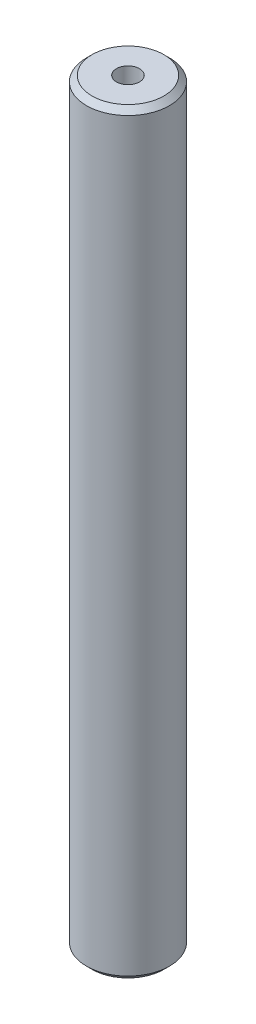
from build123d import *

# Parameters (mm, degrees)
SKETCH1_R           = 17.5
BOSS_EXTRUDE1_DEPTH = 319.289414756
SKETCH2_R           = 4.867822203
CUT_EXTRUDE1_DEPTH  = 321.247139527
CHAMFER1_SIZE       = 2.359730571


with BuildPart() as part:
    # Sketch1 → Boss-Extrude1 (new body)
    with BuildSketch(Plane(origin=(0, 0, 0), x_dir=(1, 0, 0), z_dir=(0, 1, 0))):
        Circle(SKETCH1_R)
    extrude(amount=BOSS_EXTRUDE1_DEPTH)

    # Sketch2 → Cut-Extrude1 (cut, through all)
    with BuildSketch(Plane(origin=(0, 0, 0), x_dir=(1, 0, 0), z_dir=(0, 1, 0))):
        Circle(SKETCH2_R)
    extrude(amount=CUT_EXTRUDE1_DEPTH, mode=Mode.SUBTRACT)

    # Chamfer1
    chamfer1_edges = [part.edges().sort_by_distance(p)[0] for p in [
        (-17.5, 319.289414756, 0),
        (-17.5, 0, 0),
    ]]
    chamfer(chamfer1_edges, length=CHAMFER1_SIZE)


solid = part.part
